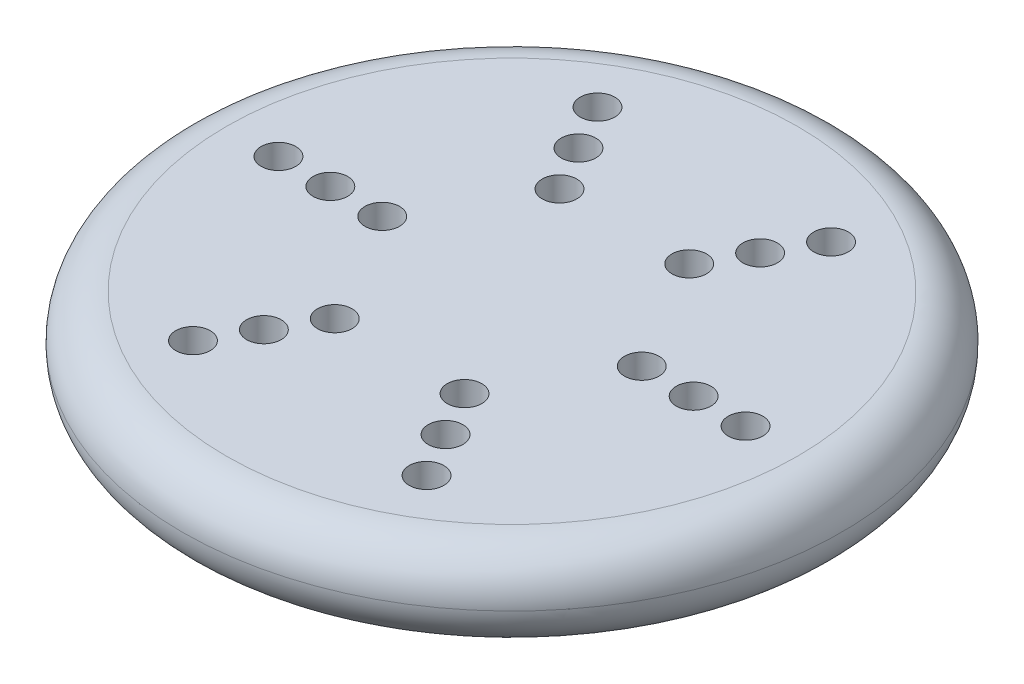
from build123d import *

# Parameters (mm, degrees)
SKETCH2_R           = 19.05
BOSS_EXTRUDE1_DEPTH = 5.08
SKETCH3_R           = 1
CUT_EXTRUDE1_DEPTH  = 28.415532094
FILLET1_R           = 2.54


with BuildPart() as part:
    # Sketch2 → Boss-Extrude1 (new body)
    with BuildSketch(Plane(origin=(0, 0, 0), x_dir=(1, 0, 0), z_dir=(0, 1, 0))):
        with Locations(Location((0, 0, 0), (0, 0, 270))):
            Circle(SKETCH2_R)
    extrude(amount=BOSS_EXTRUDE1_DEPTH)

    # Sketch3 → Cut-Extrude1 (cut, through all)
    with BuildSketch(Plane(origin=(0, 5.08, 0), x_dir=(1, 0, 0), z_dir=(0, 1, 0))):
        with Locations(Location((-6.75, -11.691342951, 0), (0, 0, 270))):
            Circle(SKETCH3_R)
        with Locations(Location((-5.25, -9.09326674, 0), (0, 0, 270))):
            Circle(SKETCH3_R)
        with Locations(Location((-3.75, -6.495190528, 0), (0, 0, 270))):
            Circle(SKETCH3_R)
        with Locations(Location((-13.5, 0, 0), (0, 0, 270))):
            Circle(SKETCH3_R)
        with Locations(Location((-10.5, 0, 0), (0, 0, 270))):
            Circle(SKETCH3_R)
        with Locations(Location((-7.5, 0, 0), (0, 0, 270))):
            Circle(SKETCH3_R)
        with Locations(Location((-3.75, 6.495190528, 0), (0, 0, 270))):
            Circle(SKETCH3_R)
        with Locations(Location((-5.25, 9.09326674, 0), (0, 0, 270))):
            Circle(SKETCH3_R)
        with Locations(Location((-6.75, 11.691342951, 0), (0, 0, 270))):
            Circle(SKETCH3_R)
        with Locations(Location((6.75, 11.691342951, 0), (0, 0, 270))):
            Circle(SKETCH3_R)
        with Locations(Location((5.25, 9.09326674, 0), (0, 0, 270))):
            Circle(SKETCH3_R)
        with Locations(Location((3.75, 6.495190528, 0), (0, 0, 270))):
            Circle(SKETCH3_R)
        with Locations(Location((13.5, 0, 0), (0, 0, 270))):
            Circle(SKETCH3_R)
        with Locations(Location((10.5, 0, 0), (0, 0, 270))):
            Circle(SKETCH3_R)
        with Locations(Location((7.5, 0, 0), (0, 0, 270))):
            Circle(SKETCH3_R)
        with Locations(Location((3.75, -6.495190528, 0), (0, 0, 270))):
            Circle(SKETCH3_R)
        with Locations(Location((5.25, -9.09326674, 0), (0, 0, 270))):
            Circle(SKETCH3_R)
        with Locations(Location((6.75, -11.691342951, 0), (0, 0, 270))):
            Circle(SKETCH3_R)
    extrude(amount=-CUT_EXTRUDE1_DEPTH, mode=Mode.SUBTRACT)

    # Fillet1
    fillet1_edges = [part.edges().sort_by_distance(p)[0] for p in [
        (0, 0, -19.05),
        (0, 5.08, -19.05),
    ]]
    fillet(fillet1_edges, radius=FILLET1_R - 0.0001)  # a hair under: the kernel refuses the full size


solid = part.part
